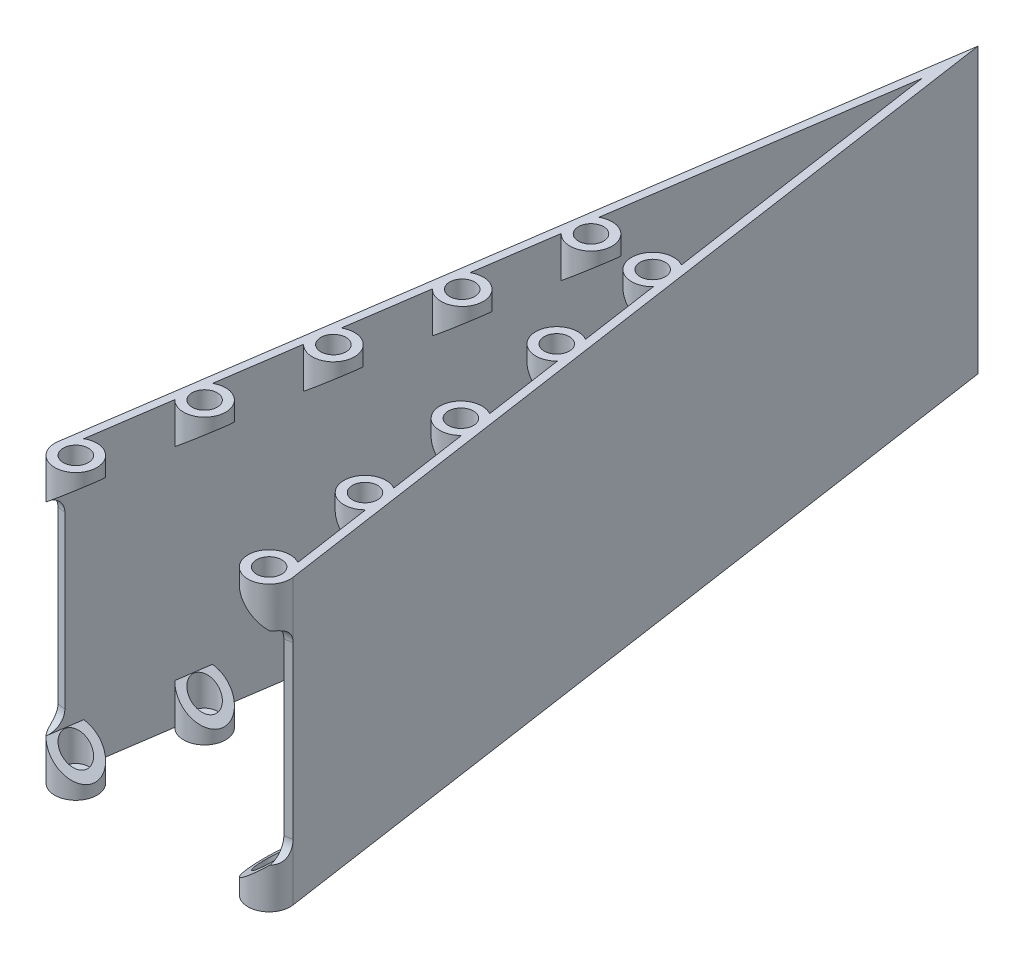
from build123d import *

# Parameters (mm, degrees)
BOSS_EXTRUDE1_DEPTH            = 35
SKETCH2_R                      = 2.6
SKETCH2_R_2                    = 1.55
BOSS_EXTRUDE3_DEPTH            = 5
CUT_EXTRUDE1_REACH             = 109.936
CUT_EXTRUDE1_DIRECTION_2_DEPTH = 108.935664458
CUT_EXTRUDE2_REACH             = 109.936
CUT_EXTRUDE2_DIRECTION_2_DEPTH = 108.935664458
FILLET1_R                      = 2
SKETCH6_R                      = 1.55
BOSS_EXTRUDE4_DEPTH            = 1


with BuildPart() as part:
    # Sketch1 → Boss-Extrude1 (new body)
    with BuildSketch(Plane(origin=(0, 0, 0), x_dir=(1, 0, 0), z_dir=(0, 1, 0))):
        Polygon((-13.5, 0), (0, 92.188031325), (13.5, 0), (14.489447114, 0.144894471), (0, 99.089605913), (-14.489447114, 0.144894471), align=None)
    extrude(amount=BOSS_EXTRUDE1_DEPTH)

    # Sketch2 → Boss-Extrude3 (add)
    # profile 1 of 10: a face of its own
    with BuildSketch(Plane(origin=(0, 0, 0), x_dir=(1, 0, 0), z_dir=(0, 1, 0))):
        with Locations((11.916884617, -0.231831154)):
            Circle(SKETCH2_R)
        with Locations(Location((11.916884617, -0.231831154, 0), (0, 0, 270))):
            Circle(SKETCH2_R_2, mode=Mode.SUBTRACT)
    # profile 2 of 10: a face of its own
    with BuildSketch(Plane(origin=(0, 0, 0), x_dir=(1, 0, 0), z_dir=(0, 1, 0))):
        with Locations((9.888362021, 13.620428448)):
            Circle(SKETCH2_R)
        with Locations(Location((9.888362021, 13.620428448, 0), (0, 0, 270))):
            Circle(SKETCH2_R_2, mode=Mode.SUBTRACT)
    # profile 3 of 10: a face of its own
    with BuildSketch(Plane(origin=(0, 0, 0), x_dir=(1, 0, 0), z_dir=(0, 1, 0))):
        with Locations((7.859839425, 27.47268805)):
            Circle(SKETCH2_R)
        with Locations(Location((7.859839425, 27.47268805, 0), (0, 0, 270))):
            Circle(SKETCH2_R_2, mode=Mode.SUBTRACT)
    # profile 4 of 10: a face of its own
    with BuildSketch(Plane(origin=(0, 0, 0), x_dir=(1, 0, 0), z_dir=(0, 1, 0))):
        with Locations((5.831316829, 41.324947652)):
            Circle(SKETCH2_R)
        with Locations(Location((5.831316829, 41.324947652, 0), (0, 0, 270))):
            Circle(SKETCH2_R_2, mode=Mode.SUBTRACT)
    # profile 5 of 10: a face of its own
    with BuildSketch(Plane(origin=(0, 0, 0), x_dir=(1, 0, 0), z_dir=(0, 1, 0))):
        with Locations((3.802794233, 55.177207254)):
            Circle(SKETCH2_R)
        with Locations(Location((3.802794233, 55.177207254, 0), (0, 0, 270))):
            Circle(SKETCH2_R_2, mode=Mode.SUBTRACT)
    # profile 6 of 10: a face of its own
    with BuildSketch(Plane(origin=(0, 0, 0), x_dir=(1, 0, 0), z_dir=(0, 1, 0))):
        with Locations((-11.916884617, -0.231831154)):
            Circle(SKETCH2_R)
        with Locations(Location((-11.916884617, -0.231831154, 0), (0, 0, 90))):
            Circle(SKETCH2_R_2, mode=Mode.SUBTRACT)
    # profile 7 of 10: a face of its own
    with BuildSketch(Plane(origin=(0, 0, 0), x_dir=(1, 0, 0), z_dir=(0, 1, 0))):
        with Locations((-9.888362021, 13.620428448)):
            Circle(SKETCH2_R)
        with Locations(Location((-9.888362021, 13.620428448, 0), (0, 0, 90))):
            Circle(SKETCH2_R_2, mode=Mode.SUBTRACT)
    # profile 8 of 10: a face of its own
    with BuildSketch(Plane(origin=(0, 0, 0), x_dir=(1, 0, 0), z_dir=(0, 1, 0))):
        with Locations((-7.859839425, 27.47268805)):
            Circle(SKETCH2_R)
        with Locations(Location((-7.859839425, 27.47268805, 0), (0, 0, 90))):
            Circle(SKETCH2_R_2, mode=Mode.SUBTRACT)
    # profile 9 of 10: a face of its own
    with BuildSketch(Plane(origin=(0, 0, 0), x_dir=(1, 0, 0), z_dir=(0, 1, 0))):
        with Locations((-5.831316829, 41.324947652)):
            Circle(SKETCH2_R)
        with Locations(Location((-5.831316829, 41.324947652, 0), (0, 0, 90))):
            Circle(SKETCH2_R_2, mode=Mode.SUBTRACT)
    # profile 10 of 10: a face of its own
    with BuildSketch(Plane(origin=(0, 0, 0), x_dir=(1, 0, 0), z_dir=(0, 1, 0))):
        with Locations((-3.802794233, 55.177207254)):
            Circle(SKETCH2_R)
        with Locations(Location((-3.802794233, 55.177207254, 0), (0, 0, 90))):
            Circle(SKETCH2_R_2, mode=Mode.SUBTRACT)
    boss_extrude3 = extrude(amount=BOSS_EXTRUDE3_DEPTH)

    # Cut-Extrude1: up to this face of the body (flat: up to its plane)
    cut_extrude1_end = Plane(part.part.faces().sort_by_distance((-6.685224914, 17.936553529, -46.536348085))[0])
    # Sketch4 → Cut-Extrude1 (cut, up to the picked face)
    with BuildSketch(Plane(origin=(0.283424505, 0, 1.935433121), x_dir=(0.9894471144188783, 0, -0.14489447114419254), z_dir=(0.14489447114419252, 0, 0.9894471144188782)), mode=Mode.PRIVATE) as cut_extrude1_sk1:
        Polygon((13.357536045, 5), (9.157536045, 5), (9.157536045, 1.475781549), align=None)
    cut_extrude1_tool1 = split(extrude(cut_extrude1_sk1.sketch, amount=-CUT_EXTRUDE1_REACH, mode=Mode.PRIVATE), bisect_by=cut_extrude1_end, keep=Keep.BOTH, mode=Mode.PRIVATE)
    cut_extrude1 = cut_extrude1_tool1.solids().sort_by(Axis((10.729548, 3.825261, 0.405705), (-0.14489447114419252, 0, -0.9894471144188782)))[0]
    add(cut_extrude1, mode=Mode.SUBTRACT)

    # Sketch4 → Cut-Extrude1 direction 2 (cut)
    with BuildSketch(Plane(origin=(0.283424505, 0, 1.935433121), x_dir=(0.9894471144188783, 0, -0.14489447114419254), z_dir=(0.14489447114419252, 0, 0.9894471144188782))):
        Polygon((13.357536045, 5), (9.157536045, 5), (9.157536045, 1.475781549), align=None)
    cut_extrude1_direction_2 = extrude(amount=CUT_EXTRUDE1_DIRECTION_2_DEPTH, mode=Mode.SUBTRACT)

    # Cut-Extrude2: up to this face of the body (flat: up to its plane)
    cut_extrude2_end = Plane(part.part.faces().sort_by_distance((6.685224914, 17.936553529, -46.536348085))[0])
    # Sketch5 → Cut-Extrude2 (cut, up to the picked face)
    with BuildSketch(Plane(origin=(-0.283424505, 0, 1.935433121), x_dir=(0.9894471144188784, 0, 0.14489447114419146), z_dir=(-0.14489447114419146, 0, 0.9894471144188784)), mode=Mode.PRIVATE) as cut_extrude2_sk1:
        Polygon((-9.157536045, 5), (-9.157536045, 1.475781549), (-13.357536045, 5), align=None)
    cut_extrude2_tool1 = split(extrude(cut_extrude2_sk1.sketch, amount=-CUT_EXTRUDE2_REACH, mode=Mode.PRIVATE), bisect_by=cut_extrude2_end, keep=Keep.BOTH, mode=Mode.PRIVATE)
    cut_extrude2 = cut_extrude2_tool1.solids().sort_by(Axis((-10.729548, 3.825261, 0.405705), (0.14489447114419146, 0, -0.9894471144188784)))[0]
    add(cut_extrude2, mode=Mode.SUBTRACT)

    # Sketch5 → Cut-Extrude2 direction 2 (cut)
    with BuildSketch(Plane(origin=(-0.283424505, 0, 1.935433121), x_dir=(0.9894471144188784, 0, 0.14489447114419146), z_dir=(-0.14489447114419146, 0, 0.9894471144188784))):
        Polygon((-9.157536045, 5), (-9.157536045, 1.475781549), (-13.357536045, 5), align=None)
    cut_extrude2_direction_2 = extrude(amount=CUT_EXTRUDE2_DIRECTION_2_DEPTH, mode=Mode.SUBTRACT)

    # Mirror2: Boss-Extrude3, Cut-Extrude1, Cut-Extrude1 direction 2, Cut-Extrude2, Cut-Extrude2 direction 2 across plane
    add(boss_extrude3.mirror(Plane.ZX.offset(17.5)))
    add(cut_extrude1.mirror(Plane.ZX.offset(17.5)), mode=Mode.SUBTRACT)
    add(cut_extrude1_direction_2.mirror(Plane.ZX.offset(17.5)), mode=Mode.SUBTRACT)
    add(cut_extrude2.mirror(Plane.ZX.offset(17.5)), mode=Mode.SUBTRACT)
    add(cut_extrude2_direction_2.mirror(Plane.ZX.offset(17.5)), mode=Mode.SUBTRACT)

    # Fillet1
    # the kernel refuses this fillet: 2 mm, written as the material it adds along each edge
    with BuildSketch(Plane(origin=(13.5, 5, 0), x_dir=(0, 1, 0), z_dir=(0.9894471144188783, 0, -0.1448944711441925))) as fillet1_piece_1_section:
        with BuildLine():
            CenterArc((FILLET1_R, FILLET1_R), FILLET1_R, 180, 90)
            Line((0, FILLET1_R), (0, 0))
            Line((0, 0), (FILLET1_R, 0))
        make_face()
    fillet1_piece_1 = extrude(amount=6, mode=Mode.PRIVATE)
    fillet1_piece_1 = fillet1_piece_1 & Plane(origin=(11.916884617, 5.699977741, 0.231831154), x_dir=(1, 0, 0), z_dir=(0, -1, 0)) * Cylinder(2.6, 20, mode=Mode.PRIVATE)
    add(fillet1_piece_1)
    with BuildSketch(Plane(origin=(13.5, 30, 0), x_dir=(0, -1, 0), z_dir=(0.9894471144188783, 0, -0.1448944711441925))) as fillet1_piece_2_section:
        with BuildLine():
            CenterArc((FILLET1_R, -FILLET1_R), FILLET1_R, 90, 90)
            Line((0, -FILLET1_R), (0, 0))
            Line((0, 0), (FILLET1_R, 0))
        make_face()
    fillet1_piece_2 = extrude(amount=6, mode=Mode.PRIVATE)
    fillet1_piece_2 = fillet1_piece_2 & Plane(origin=(11.916884617, 29.30002226, 0.231831154), x_dir=(1, 0, 0), z_dir=(0, 1, 0)) * Cylinder(2.6, 20, mode=Mode.PRIVATE)
    add(fillet1_piece_2)
    with BuildSketch(Plane(origin=(-19.436682687, 30, -0.869366827), x_dir=(0, -1, 0), z_dir=(0.9894471144188784, 0, 0.1448944711441914))) as fillet1_piece_3_section:
        with BuildLine():
            CenterArc((FILLET1_R, -FILLET1_R), FILLET1_R, 90, 90)
            Line((0, -FILLET1_R), (0, 0))
            Line((0, 0), (FILLET1_R, 0))
        make_face()
    fillet1_piece_3 = extrude(amount=6, mode=Mode.PRIVATE)
    fillet1_piece_3 = fillet1_piece_3 & Plane(origin=(-11.916884617, 29.777637105, 0.231831154), x_dir=(1, 0, 0), z_dir=(0, 1, 0)) * Cylinder(2.6, 21, mode=Mode.PRIVATE)
    add(fillet1_piece_3)
    with BuildSketch(Plane(origin=(-19.436682687, 5, -0.869366827), x_dir=(-0.1448944711441914, 0, 0.9894471144188784), z_dir=(0.9894471144188784, 0, 0.1448944711441914))) as fillet1_piece_4_section:
        with BuildLine():
            CenterArc((FILLET1_R, -FILLET1_R), FILLET1_R, 90, 90)
            Line((0, -FILLET1_R), (0, 0))
            Line((0, 0), (FILLET1_R, 0))
        make_face()
    fillet1_piece_4 = extrude(amount=6, mode=Mode.PRIVATE)
    fillet1_piece_4 = fillet1_piece_4 & Plane(origin=(-11.916884617, 5.222362792, 0.231831154), x_dir=(1, 0, 0), z_dir=(0, -1, 0)) * Cylinder(2.6, 21, mode=Mode.PRIVATE)
    add(fillet1_piece_4)

    # Sketch6 → Boss-Extrude4 (add)
    with BuildSketch(Plane.XZ):
        with Locations(Location((3.802794233, -55.177207254, 0), (0, 0, 270))):
            Circle(SKETCH6_R)
        with Locations(Location((-3.802794233, -55.177207254, 0), (0, 0, 270))):
            Circle(SKETCH6_R)
        with Locations(Location((-5.831316829, -41.324947652, 0), (0, 0, 270))):
            Circle(SKETCH6_R)
        with Locations(Location((5.831316829, -41.324947652, 0), (0, 0, 270))):
            Circle(SKETCH6_R)
        with Locations(Location((7.859839425, -27.47268805, 0), (0, 0, 270))):
            Circle(SKETCH6_R)
        with Locations(Location((-7.859839425, -27.47268805, 0), (0, 0, 270))):
            Circle(SKETCH6_R)
        with Locations(Location((-9.888362021, -13.620428448, 0), (0, 0, 270))):
            Circle(SKETCH6_R)
        with Locations(Location((9.888362021, -13.620428448, 0), (0, 0, 270))):
            Circle(SKETCH6_R)
        with Locations(Location((11.916884617, 0.231831154, 0), (0, 0, 270))):
            Circle(SKETCH6_R)
        with Locations(Location((-11.916884617, 0.231831154, 0), (0, 0, 270))):
            Circle(SKETCH6_R)
    extrude(amount=-BOSS_EXTRUDE4_DEPTH)


solid = part.part
